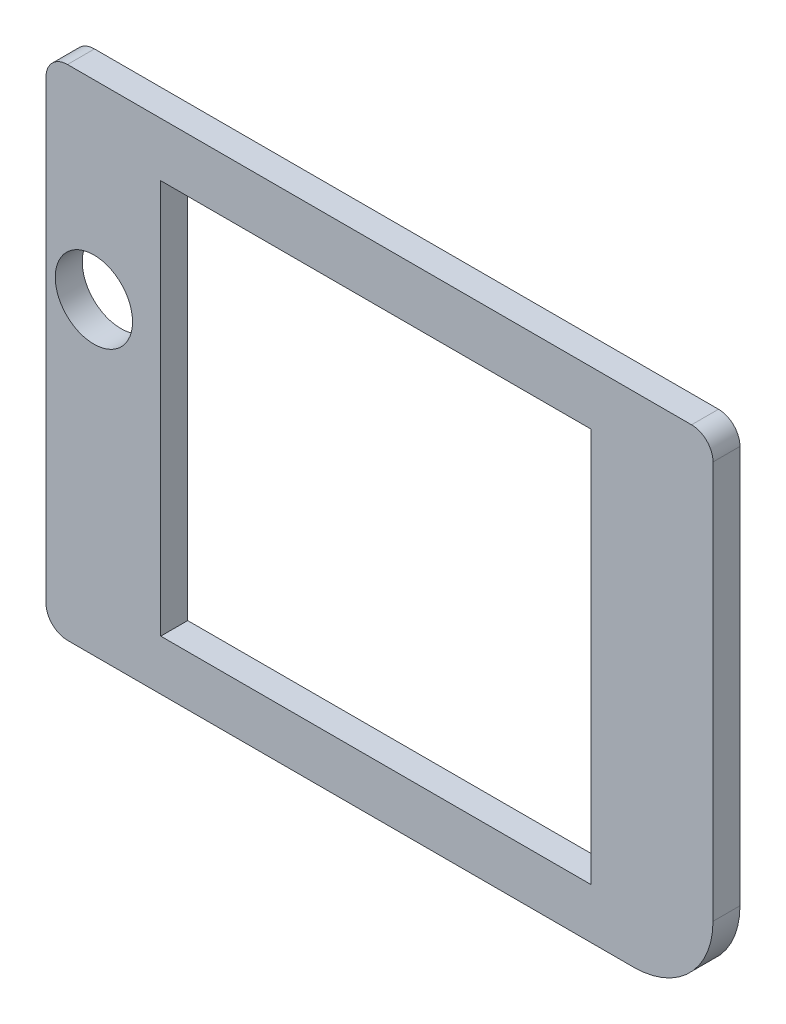
from build123d import *

# Parameters (mm, degrees)
SKETCH1_W           = 50.090098238
SKETCH1_H           = 45.92830966
SKETCH1_R           = 4.5
BOSS_EXTRUDE2_DEPTH = 3.14


with BuildPart() as part:
    # Sketch1 → Boss-Extrude2 (new body)
    with BuildSketch(Plane.XY):
        with BuildLine():
            Line((39.139308268, 13.683084381), (39.139308268, 60.005147218))
            ThreePointArc((39.139308268, 60.005147218), (38.40707522, 61.772914171), (36.639308268, 62.505147218))
            Line((36.639308268, 62.505147218), (-36.027217939, 62.505147218))
            ThreePointArc((-36.027217939, 62.505147218), (-37.794984892, 61.772914171), (-38.527217939, 60.005147218))
            Line((-38.527217939, 60.005147218), (-38.527217939, 6.933084381))
            ThreePointArc((-38.527217939, 6.933084381), (-37.794984892, 5.165317428), (-36.027217939, 4.433084381))
            Line((-36.027217939, 4.433084381), (29.889308268, 4.433084381))
            ThreePointArc((29.889308268, 4.433084381), (36.430045993, 7.142346655), (39.139308268, 13.683084381))
        make_face()
        with Locations((-0.122821054, 33.25213261)):
            Rectangle(SKETCH1_W, SKETCH1_H, mode=Mode.SUBTRACT)
        with Locations((-32.953932198, 40.341063425)):
            Circle(SKETCH1_R, mode=Mode.SUBTRACT)
    extrude(amount=BOSS_EXTRUDE2_DEPTH)


solid = part.part
